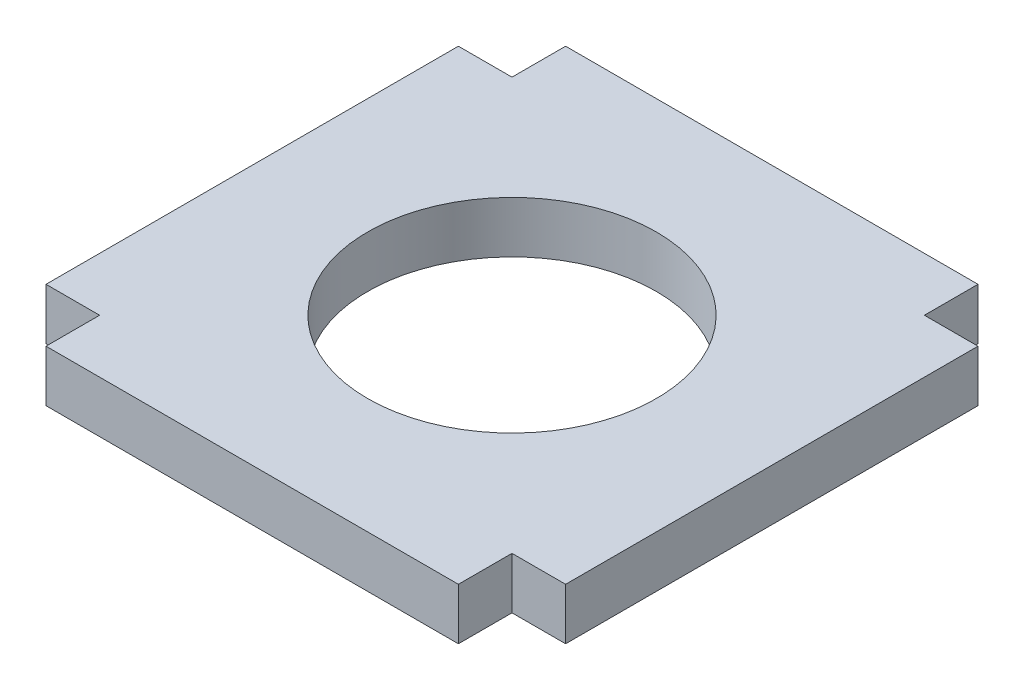
from build123d import *

# Parameters (mm, degrees)
SKETCH2_W                    = 304.8
SKETCH2_H                    = 304.8
BOSS_EXTRUDE1_DEPTH          = 3.175
CUT_EXTRUDE1_DEPTH           = 348.408852067
CUT_EXTRUDE1_DEPTH_BACK      = 348.408852067
SKETCH3_W                    = 304.8
SKETCH3_H                    = 304.8
SKETCH3_R                    = 12.7
SKETCH3_R_2                  = 8.89
BODY_DELETE_KEEP_1_OUTLINE_R = 12.7
BODY_DELETE_KEEP_1_DEPTH     = 3.175


# Read off the part's stored shape, not the designer's step: Body-Delete/Keep 1
with BuildPart() as part:
    # Sketch2 → Boss-Extrude1 (new body)
    with BuildSketch(Plane(origin=(0, 0, 0), x_dir=(1, 0, 0), z_dir=(0, 1, 0))):
        with Locations((-56.763509666, -124.968808797)):
            Rectangle(SKETCH2_W, SKETCH2_H)
    extrude(amount=BOSS_EXTRUDE1_DEPTH)

    # Sketch3 → Cut-Extrude1 (cut, two sides: drawn at the far end of the back side and taken through both)
    # profile 1 of 3: a face of its own
    with BuildSketch(Plane(origin=(0, 3.175, 0), x_dir=(1, 0, 0), z_dir=(0, 1, 0)).offset(-CUT_EXTRUDE1_DEPTH_BACK)):
        with Locations((-56.763509666, -124.968808797)):
            Rectangle(SKETCH3_W, SKETCH3_H)
        Polygon((-188.253637726, -268.695366412), (-192.063637726, -268.695366412), (-192.063637726, -265.393366412), (-198.413637726, -265.393366412), (-188.253637726, -205.195366412), align=None, mode=Mode.SUBTRACT)
        Polygon((-185.713637726, -265.393366412), (-175.553637726, -205.195366412), (-175.553637726, -268.695366412), (-179.363637726, -268.695366412), (-179.363637726, -265.393366412), align=None, mode=Mode.SUBTRACT)
        Polygon((-162.853637726, -268.695366412), (-166.663637726, -268.695366412), (-166.663637726, -265.393366412), (-173.013637726, -265.393366412), (-162.853637726, -205.195366412), align=None, mode=Mode.SUBTRACT)
        Polygon((-150.153637726, -268.695366412), (-153.963637726, -268.695366412), (-153.963637726, -265.393366412), (-160.313637726, -265.393366412), (-150.153637726, -205.195366412), align=None, mode=Mode.SUBTRACT)
        Polygon((-147.613637726, -265.393366412), (-137.453637726, -205.195366412), (-137.453637726, -268.695366412), (-141.263637726, -268.695366412), (-141.263637726, -265.393366412), align=None, mode=Mode.SUBTRACT)
        Polygon((-128.563637726, -265.393366412), (-134.913637726, -265.393366412), (-124.753637726, -205.195366412), (-124.753637726, -268.695366412), (-128.563637726, -268.695366412), align=None, mode=Mode.SUBTRACT)
        Polygon((-122.213637726, -265.393366412), (-112.053637726, -205.195366412), (-112.053637726, -268.695366412), (-115.863637726, -268.695366412), (-115.863637726, -265.393366412), align=None, mode=Mode.SUBTRACT)
        Polygon((-99.353637726, -268.695366412), (-103.163637726, -268.695366412), (-103.163637726, -265.393366412), (-109.513637726, -265.393366412), (-99.353637726, -205.195366412), align=None, mode=Mode.SUBTRACT)
        Polygon((-90.463637726, -268.695366412), (-90.463637726, -265.393366412), (-96.813637726, -265.393366412), (-86.653637726, -205.195366412), (-86.653637726, -268.695366412), align=None, mode=Mode.SUBTRACT)
        Polygon((-84.113637726, -265.393366412), (-73.953637726, -205.195366412), (-73.953637726, -268.695366412), (-77.763637726, -268.695366412), (-77.763637726, -265.393366412), align=None, mode=Mode.SUBTRACT)
        Polygon((-71.413637726, -265.393366412), (-61.253637726, -205.195366412), (-61.253637726, -268.695366412), (-65.063637726, -268.695366412), (-65.063637726, -265.393366412), align=None, mode=Mode.SUBTRACT)
        with BuildLine():
            ThreePointArc((-132.963509666, -135.600090559), (-133.446874634, -138.030130355), (-134.823381605, -140.09021862))
            Line((-134.823381605, -140.09021862), (-188.253637726, -193.520474741))
            ThreePointArc((-188.253637726, -193.520474741), (-190.313725991, -194.896981712), (-192.743765787, -195.38034668))
            Line((-192.743765787, -195.38034668), (-196.463509666, -195.38034668))
            Line((-196.463509666, -195.38034668), (-196.463509666, -131.88034668))
            Line((-196.463509666, -131.88034668), (-132.963509666, -131.88034668))
            Line((-132.963509666, -131.88034668), (-132.963509666, -135.600090559))
        make_face(mode=Mode.SUBTRACT)
        with BuildLine():
            Line((-126.613509666, -195.38034668), (-126.613509666, -131.88034668))
            Line((-126.613509666, -131.88034668), (-63.113509666, -131.88034668))
            Line((-63.113509666, -131.88034668), (-63.113509666, -135.600090559))
            ThreePointArc((-63.113509666, -135.600090559), (-63.596874634, -138.030130355), (-64.973381605, -140.09021862))
            Line((-64.973381605, -140.09021862), (-118.403637726, -193.520474741))
            ThreePointArc((-118.403637726, -193.520474741), (-120.463725991, -194.896981712), (-122.893765787, -195.38034668))
            Line((-122.893765787, -195.38034668), (-126.613509666, -195.38034668))
        make_face(mode=Mode.SUBTRACT)
        Polygon((-52.363637726, -268.695366412), (-52.363637726, -265.393366412), (-58.713637726, -265.393366412), (-48.553637726, -205.195366412), (-48.553637726, -268.695366412), align=None, mode=Mode.SUBTRACT)
        Polygon((-35.853637726, -205.195366412), (-35.853637726, -268.695366412), (-39.663637726, -268.695366412), (-39.663637726, -265.393366412), (-46.013637726, -265.393366412), align=None, mode=Mode.SUBTRACT)
        Polygon((-23.153637726, -205.195366412), (-23.153637726, -268.695366412), (-26.963637726, -268.695366412), (-26.963637726, -265.393366412), (-33.313637726, -265.393366412), align=None, mode=Mode.SUBTRACT)
        Polygon((-20.613637726, -265.393366412), (-10.453637726, -205.195366412), (-10.453637726, -268.695366412), (-14.263637726, -268.695366412), (-14.263637726, -265.393366412), align=None, mode=Mode.SUBTRACT)
        Polygon((-1.563637726, -268.695366412), (-1.563637726, -265.393366412), (-7.913637726, -265.393366412), (2.246362274, -205.195366412), (2.246362274, -268.695366412), align=None, mode=Mode.SUBTRACT)
        with BuildLine():
            Line((-53.043765787, -195.38034668), (-56.763509666, -195.38034668))
            Line((-56.763509666, -195.38034668), (-56.763509666, -131.88034668))
            Line((-56.763509666, -131.88034668), (6.736490334, -131.88034668))
            Line((6.736490334, -131.88034668), (6.736490334, -135.600090559))
            ThreePointArc((6.736490334, -135.600090559), (6.253125366, -138.030130355), (4.876618395, -140.09021862))
            Line((4.876618395, -140.09021862), (-48.553637726, -193.520474741))
            ThreePointArc((-48.553637726, -193.520474741), (-50.613725991, -194.896981712), (-53.043765787, -195.38034668))
        make_face(mode=Mode.SUBTRACT)
        with BuildLine():
            Line((13.086490334, -131.88034668), (76.586490334, -131.88034668))
            Line((76.586490334, -131.88034668), (76.586490334, -135.600090559))
            ThreePointArc((76.586490334, -135.600090559), (76.103125366, -138.030130355), (74.726618395, -140.09021862))
            Line((74.726618395, -140.09021862), (21.296362274, -193.520474741))
            ThreePointArc((21.296362274, -193.520474741), (19.236274009, -194.896981712), (16.806234213, -195.38034668))
            Line((16.806234213, -195.38034668), (13.086490334, -195.38034668))
            Line((13.086490334, -195.38034668), (13.086490334, -131.88034668))
        make_face(mode=Mode.SUBTRACT)
        with BuildLine():
            Line((-196.463509666, -125.53034668), (-196.463509666, -62.03034668))
            Line((-196.463509666, -62.03034668), (-132.963509666, -62.03034668))
            Line((-132.963509666, -62.03034668), (-132.963509666, -65.750090559))
            ThreePointArc((-132.963509666, -65.750090559), (-133.10773728, -67.095783354), (-133.533868437, -68.38034668))
            ThreePointArc((-133.533868437, -68.38034668), (-134.095097913, -69.368194866), (-134.823381605, -70.24021862))
            Line((-134.823381605, -70.24021862), (-188.253637726, -123.670474741))
            ThreePointArc((-188.253637726, -123.670474741), (-189.12566148, -124.398758433), (-190.113509666, -124.959987909))
            ThreePointArc((-190.113509666, -124.959987909), (-191.398072992, -125.386119066), (-192.743765787, -125.53034668))
            Line((-192.743765787, -125.53034668), (-196.463509666, -125.53034668))
        make_face(mode=Mode.SUBTRACT)
        with BuildLine():
            Line((-122.893765787, -125.53034668), (-126.613509666, -125.53034668))
            Line((-126.613509666, -125.53034668), (-126.613509666, -62.03034668))
            Line((-126.613509666, -62.03034668), (-63.113509666, -62.03034668))
            Line((-63.113509666, -62.03034668), (-63.113509666, -65.750090559))
            ThreePointArc((-63.113509666, -65.750090559), (-63.596874634, -68.180130355), (-64.973381605, -70.24021862))
            Line((-64.973381605, -70.24021862), (-118.403637726, -123.670474741))
            ThreePointArc((-118.403637726, -123.670474741), (-120.463725991, -125.046981712), (-122.893765787, -125.53034668))
        make_face(mode=Mode.SUBTRACT)
        Polygon((-196.463509666, -48.768808797), (-196.463509666, 14.731191203), (-192.653509666, 14.731191203), (-192.653509666, 11.429191203), (-186.303509666, 11.429191203), align=None, mode=Mode.SUBTRACT)
        Polygon((-183.763509666, 14.731191203), (-179.953509666, 14.731191203), (-179.953509666, 11.429191203), (-173.603509666, 11.429191203), (-183.763509666, -48.768808797), align=None, mode=Mode.SUBTRACT)
        Polygon((-171.063509666, 14.731191203), (-167.253509666, 14.731191203), (-167.253509666, 11.429191203), (-160.903509666, 11.429191203), (-171.063509666, -48.768808797), align=None, mode=Mode.SUBTRACT)
        Polygon((-158.363509666, 14.731191203), (-154.553509666, 14.731191203), (-154.553509666, 11.429191203), (-148.203509666, 11.429191203), (-158.363509666, -48.768808797), align=None, mode=Mode.SUBTRACT)
        Polygon((-145.663509666, 14.731191203), (-141.853509666, 14.731191203), (-141.853509666, 11.429191203), (-135.503509666, 11.429191203), (-145.663509666, -48.768808797), align=None, mode=Mode.SUBTRACT)
        Polygon((-132.963509666, 14.731191203), (-129.153509666, 14.731191203), (-129.153509666, 11.429191203), (-122.803509666, 11.429191203), (-132.963509666, -48.768808797), align=None, mode=Mode.SUBTRACT)
        Polygon((-120.263509666, 14.731191203), (-116.453509666, 14.731191203), (-116.453509666, 11.429191203), (-110.103509666, 11.429191203), (-120.263509666, -48.768808797), align=None, mode=Mode.SUBTRACT)
        Polygon((-107.563509666, 14.731191203), (-103.753509666, 14.731191203), (-103.753509666, 11.429191203), (-97.403509666, 11.429191203), (-107.563509666, -48.768808797), align=None, mode=Mode.SUBTRACT)
        Polygon((-94.863509666, 14.731191203), (-91.053509666, 14.731191203), (-91.053509666, 11.429191203), (-84.703509666, 11.429191203), (-94.863509666, -48.768808797), align=None, mode=Mode.SUBTRACT)
        Polygon((-82.163509666, 14.731191203), (-78.353509666, 14.731191203), (-78.353509666, 11.429191203), (-72.003509666, 11.429191203), (-82.163509666, -48.768808797), align=None, mode=Mode.SUBTRACT)
        Polygon((-69.463509666, 14.731191203), (-65.653509666, 14.731191203), (-65.653509666, 11.429191203), (-59.303509666, 11.429191203), (-69.463509666, -48.768808797), align=None, mode=Mode.SUBTRACT)
        with BuildLine():
            Line((-53.043765787, -125.53034668), (-56.763509666, -125.53034668))
            Line((-56.763509666, -125.53034668), (-56.763509666, -62.03034668))
            Line((-56.763509666, -62.03034668), (6.736490334, -62.03034668))
            Line((6.736490334, -62.03034668), (6.736490334, -65.750090559))
            ThreePointArc((6.736490334, -65.750090559), (6.253125366, -68.180130355), (4.876618395, -70.24021862))
            Line((4.876618395, -70.24021862), (-48.553637726, -123.670474741))
            ThreePointArc((-48.553637726, -123.670474741), (-50.613725991, -125.046981712), (-53.043765787, -125.53034668))
        make_face(mode=Mode.SUBTRACT)
        with BuildLine():
            Line((16.806234213, -125.53034668), (13.086490334, -125.53034668))
            Line((13.086490334, -125.53034668), (13.086490334, -62.03034668))
            Line((13.086490334, -62.03034668), (76.586490334, -62.03034668))
            Line((76.586490334, -62.03034668), (76.586490334, -65.750090559))
            ThreePointArc((76.586490334, -65.750090559), (76.103125366, -68.180130355), (74.726618395, -70.24021862))
            Line((74.726618395, -70.24021862), (21.296362274, -123.670474741))
            ThreePointArc((21.296362274, -123.670474741), (19.236274009, -125.046981712), (16.806234213, -125.53034668))
        make_face(mode=Mode.SUBTRACT)
        Polygon((-56.763509666, 14.731191203), (-52.953509666, 14.731191203), (-52.953509666, 11.429191203), (-46.603509666, 11.429191203), (-56.763509666, -48.768808797), align=None, mode=Mode.SUBTRACT)
        Polygon((-44.063509666, 14.731191203), (-40.253509666, 14.731191203), (-40.253509666, 11.429191203), (-33.903509666, 11.429191203), (-44.063509666, -48.768808797), align=None, mode=Mode.SUBTRACT)
        Polygon((-31.363509666, 14.731191203), (-27.553509666, 14.731191203), (-27.553509666, 11.429191203), (-21.203509666, 11.429191203), (-31.363509666, -48.768808797), align=None, mode=Mode.SUBTRACT)
        Polygon((-18.663509666, 14.731191203), (-14.853509666, 14.731191203), (-14.853509666, 11.429191203), (-8.503509666, 11.429191203), (-18.663509666, -48.768808797), align=None, mode=Mode.SUBTRACT)
        Polygon((-5.963509666, 14.731191203), (-2.153509666, 14.731191203), (-2.153509666, 11.429191203), (4.196490334, 11.429191203), (-5.963509666, -48.768808797), align=None, mode=Mode.SUBTRACT)
        Polygon((57.536490334, -48.768808797), (57.536490334, -52.070808797), (32.136490334, -52.070808797), (32.136490334, -48.768808797), (28.834490334, -48.768808797), (28.834490334, -23.368808797), (32.136490334, -23.368808797), (32.136490334, -20.066808797), (57.536490334, -20.066808797), (57.536490334, -23.368808797), (60.838490334, -23.368808797), (60.838490334, -48.768808797), align=None, mode=Mode.SUBTRACT)
        Polygon((28.834490334, 14.731191203), (32.136490334, 14.731191203), (32.136490334, 18.033191203), (57.536490334, 18.033191203), (57.536490334, 14.731191203), (60.838490334, 14.731191203), (60.838490334, -10.668808797), (57.536490334, -10.668808797), (57.536490334, -13.970808797), (32.136490334, -13.970808797), (32.136490334, -10.668808797), (28.834490334, -10.668808797), align=None, mode=Mode.SUBTRACT)
    # profile 2 of 3: a face of its own
    with BuildSketch(Plane(origin=(0, 3.175, 0), x_dir=(1, 0, 0), z_dir=(0, 1, 0)).offset(-CUT_EXTRUDE1_DEPTH_BACK)):
        with Locations(Location((44.836490334, -36.068808797, 0), (0, 0, 270))):
            Circle(SKETCH3_R)
    # profile 3 of 3: a face of its own
    with BuildSketch(Plane(origin=(0, 3.175, 0), x_dir=(1, 0, 0), z_dir=(0, 1, 0)).offset(-CUT_EXTRUDE1_DEPTH_BACK)):
        with Locations(Location((44.836490334, 2.031191203, 0), (0, 0, 270))):
            Circle(SKETCH3_R_2)
    extrude(amount=CUT_EXTRUDE1_DEPTH + CUT_EXTRUDE1_DEPTH_BACK, mode=Mode.SUBTRACT)

    # Body-Delete/Keep 1 outline → Body-Delete/Keep 1 (cut)
    # profile 1 of 41: a face of its own
    with BuildSketch(Plane(origin=(0, 0, 0), x_dir=(1, 0, 0), z_dir=(0, 1, 0))):
        Polygon((60.838490334, -23.368808797), (57.536490334, -23.368808797), (57.536490334, -20.066808797), (32.136490334, -20.066808797), (32.136490334, -23.368808797), (28.834490334, -23.368808797), (28.834490334, -48.768808797), (32.136490334, -48.768808797), (32.136490334, -52.070808797), (57.536490334, -52.070808797), (57.536490334, -48.768808797), (60.838490334, -48.768808797), align=None)
        with Locations((44.836490334, -36.068808797)):
            Circle(BODY_DELETE_KEEP_1_OUTLINE_R, mode=Mode.SUBTRACT)
    # profile 2 of 41: a face of its own
    with BuildSketch(Plane(origin=(0, 0, 0), x_dir=(1, 0, 0), z_dir=(0, 1, 0))):
        Polygon((-192.653509666, 11.429191203), (-192.653509666, 14.731191203), (-196.463509666, 14.731191203), (-196.463509666, -48.768808797), (-186.303509666, 11.429191203), align=None)
    # profile 3 of 41: a face of its own
    with BuildSketch(Plane(origin=(0, 0, 0), x_dir=(1, 0, 0), z_dir=(0, 1, 0))):
        Polygon((-2.153509666, 11.429191203), (-2.153509666, 14.731191203), (-5.963509666, 14.731191203), (-5.963509666, -48.768808797), (4.196490334, 11.429191203), align=None)
    # profile 4 of 41: a face of its own
    with BuildSketch(Plane(origin=(0, 0, 0), x_dir=(1, 0, 0), z_dir=(0, 1, 0))):
        Polygon((-27.553509666, 11.429191203), (-27.553509666, 14.731191203), (-31.363509666, 14.731191203), (-31.363509666, -48.768808797), (-21.203509666, 11.429191203), align=None)
    # profile 5 of 41: a face of its own
    with BuildSketch(Plane(origin=(0, 0, 0), x_dir=(1, 0, 0), z_dir=(0, 1, 0))):
        Polygon((-14.853509666, 11.429191203), (-14.853509666, 14.731191203), (-18.663509666, 14.731191203), (-18.663509666, -48.768808797), (-8.503509666, 11.429191203), align=None)
    # profile 6 of 41: a face of its own
    with BuildSketch(Plane(origin=(0, 0, 0), x_dir=(1, 0, 0), z_dir=(0, 1, 0))):
        Polygon((-65.653509666, 11.429191203), (-65.653509666, 14.731191203), (-69.463509666, 14.731191203), (-69.463509666, -48.768808797), (-59.303509666, 11.429191203), align=None)
    # profile 7 of 41: a face of its own
    with BuildSketch(Plane(origin=(0, 0, 0), x_dir=(1, 0, 0), z_dir=(0, 1, 0))):
        Polygon((-91.053509666, 11.429191203), (-91.053509666, 14.731191203), (-94.863509666, 14.731191203), (-94.863509666, -48.768808797), (-84.703509666, 11.429191203), align=None)
    # profile 8 of 41: a face of its own
    with BuildSketch(Plane(origin=(0, 0, 0), x_dir=(1, 0, 0), z_dir=(0, 1, 0))):
        Polygon((-40.253509666, 11.429191203), (-40.253509666, 14.731191203), (-44.063509666, 14.731191203), (-44.063509666, -48.768808797), (-33.903509666, 11.429191203), align=None)
    # profile 9 of 41: a face of its own
    with BuildSketch(Plane(origin=(0, 0, 0), x_dir=(1, 0, 0), z_dir=(0, 1, 0))):
        Polygon((-52.953509666, 11.429191203), (-52.953509666, 14.731191203), (-56.763509666, 14.731191203), (-56.763509666, -48.768808797), (-46.603509666, 11.429191203), align=None)
    # profile 10 of 41: a face of its own
    with BuildSketch(Plane(origin=(0, 0, 0), x_dir=(1, 0, 0), z_dir=(0, 1, 0))):
        Polygon((-141.853509666, 11.429191203), (-141.853509666, 14.731191203), (-145.663509666, 14.731191203), (-145.663509666, -48.768808797), (-135.503509666, 11.429191203), align=None)
    # profile 11 of 41: a face of its own
    with BuildSketch(Plane(origin=(0, 0, 0), x_dir=(1, 0, 0), z_dir=(0, 1, 0))):
        Polygon((-154.553509666, 11.429191203), (-154.553509666, 14.731191203), (-158.363509666, 14.731191203), (-158.363509666, -48.768808797), (-148.203509666, 11.429191203), align=None)
    # profile 12 of 41: a face of its own
    with BuildSketch(Plane(origin=(0, 0, 0), x_dir=(1, 0, 0), z_dir=(0, 1, 0))):
        Polygon((-167.253509666, 11.429191203), (-167.253509666, 14.731191203), (-171.063509666, 14.731191203), (-171.063509666, -48.768808797), (-160.903509666, 11.429191203), align=None)
    # profile 13 of 41: a face of its own
    with BuildSketch(Plane(origin=(0, 0, 0), x_dir=(1, 0, 0), z_dir=(0, 1, 0))):
        Polygon((-78.353509666, 11.429191203), (-78.353509666, 14.731191203), (-82.163509666, 14.731191203), (-82.163509666, -48.768808797), (-72.003509666, 11.429191203), align=None)
    # profile 14 of 41: a face of its own
    with BuildSketch(Plane(origin=(0, 0, 0), x_dir=(1, 0, 0), z_dir=(0, 1, 0))):
        Polygon((-179.953509666, 11.429191203), (-179.953509666, 14.731191203), (-183.763509666, 14.731191203), (-183.763509666, -48.768808797), (-173.603509666, 11.429191203), align=None)
    # profile 15 of 41: a face of its own
    with BuildSketch(Plane(origin=(0, 0, 0), x_dir=(1, 0, 0), z_dir=(0, 1, 0))):
        Polygon((-103.753509666, 11.429191203), (-103.753509666, 14.731191203), (-107.563509666, 14.731191203), (-107.563509666, -48.768808797), (-97.403509666, 11.429191203), align=None)
    # profile 16 of 41: a face of its own
    with BuildSketch(Plane(origin=(0, 0, 0), x_dir=(1, 0, 0), z_dir=(0, 1, 0))):
        Polygon((-116.453509666, 11.429191203), (-116.453509666, 14.731191203), (-120.263509666, 14.731191203), (-120.263509666, -48.768808797), (-110.103509666, 11.429191203), align=None)
    # profile 17 of 41: a face of its own
    with BuildSketch(Plane(origin=(0, 0, 0), x_dir=(1, 0, 0), z_dir=(0, 1, 0))):
        Polygon((-129.153509666, 11.429191203), (-129.153509666, 14.731191203), (-132.963509666, 14.731191203), (-132.963509666, -48.768808797), (-122.803509666, 11.429191203), align=None)
    # profile 18 of 41: a face of its own
    with BuildSketch(Plane(origin=(0, 0, 0), x_dir=(1, 0, 0), z_dir=(0, 1, 0))):
        Polygon((-71.413637726, -265.393366412), (-65.063637726, -265.393366412), (-65.063637726, -268.695366412), (-61.253637726, -268.695366412), (-61.253637726, -205.195366412), align=None)
    # profile 19 of 41: a face of its own
    with BuildSketch(Plane(origin=(0, 0, 0), x_dir=(1, 0, 0), z_dir=(0, 1, 0))):
        Polygon((-124.753637726, -205.195366412), (-134.913637726, -265.393366412), (-128.563637726, -265.393366412), (-128.563637726, -268.695366412), (-124.753637726, -268.695366412), align=None)
    # profile 20 of 41: a face of its own
    with BuildSketch(Plane(origin=(0, 0, 0), x_dir=(1, 0, 0), z_dir=(0, 1, 0))):
        Polygon((-23.153637726, -205.195366412), (-33.313637726, -265.393366412), (-26.963637726, -265.393366412), (-26.963637726, -268.695366412), (-23.153637726, -268.695366412), align=None)
    # profile 21 of 41: a face of its own
    with BuildSketch(Plane(origin=(0, 0, 0), x_dir=(1, 0, 0), z_dir=(0, 1, 0))):
        Polygon((-35.853637726, -205.195366412), (-46.013637726, -265.393366412), (-39.663637726, -265.393366412), (-39.663637726, -268.695366412), (-35.853637726, -268.695366412), align=None)
    # profile 22 of 41: a face of its own
    with BuildSketch(Plane(origin=(0, 0, 0), x_dir=(1, 0, 0), z_dir=(0, 1, 0))):
        Polygon((-73.953637726, -205.195366412), (-84.113637726, -265.393366412), (-77.763637726, -265.393366412), (-77.763637726, -268.695366412), (-73.953637726, -268.695366412), align=None)
    # profile 23 of 41: a face of its own
    with BuildSketch(Plane(origin=(0, 0, 0), x_dir=(1, 0, 0), z_dir=(0, 1, 0))):
        Polygon((-162.853637726, -205.195366412), (-173.013637726, -265.393366412), (-166.663637726, -265.393366412), (-166.663637726, -268.695366412), (-162.853637726, -268.695366412), align=None)
    # profile 24 of 41: a face of its own
    with BuildSketch(Plane(origin=(0, 0, 0), x_dir=(1, 0, 0), z_dir=(0, 1, 0))):
        Polygon((-188.253637726, -205.195366412), (-198.413637726, -265.393366412), (-192.063637726, -265.393366412), (-192.063637726, -268.695366412), (-188.253637726, -268.695366412), align=None)
    # profile 25 of 41: a face of its own
    with BuildSketch(Plane(origin=(0, 0, 0), x_dir=(1, 0, 0), z_dir=(0, 1, 0))):
        Polygon((-175.553637726, -205.195366412), (-185.713637726, -265.393366412), (-179.363637726, -265.393366412), (-179.363637726, -268.695366412), (-175.553637726, -268.695366412), align=None)
    # profile 26 of 41: a face of its own
    with BuildSketch(Plane(origin=(0, 0, 0), x_dir=(1, 0, 0), z_dir=(0, 1, 0))):
        Polygon((-150.153637726, -205.195366412), (-160.313637726, -265.393366412), (-153.963637726, -265.393366412), (-153.963637726, -268.695366412), (-150.153637726, -268.695366412), align=None)
    # profile 27 of 41: a face of its own
    with BuildSketch(Plane(origin=(0, 0, 0), x_dir=(1, 0, 0), z_dir=(0, 1, 0))):
        Polygon((-86.653637726, -205.195366412), (-96.813637726, -265.393366412), (-90.463637726, -265.393366412), (-90.463637726, -268.695366412), (-86.653637726, -268.695366412), align=None)
    # profile 28 of 41: a face of its own
    with BuildSketch(Plane(origin=(0, 0, 0), x_dir=(1, 0, 0), z_dir=(0, 1, 0))):
        Polygon((2.246362274, -205.195366412), (-7.913637726, -265.393366412), (-1.563637726, -265.393366412), (-1.563637726, -268.695366412), (2.246362274, -268.695366412), align=None)
    # profile 29 of 41: a face of its own
    with BuildSketch(Plane(origin=(0, 0, 0), x_dir=(1, 0, 0), z_dir=(0, 1, 0))):
        Polygon((-137.453637726, -205.195366412), (-147.613637726, -265.393366412), (-141.263637726, -265.393366412), (-141.263637726, -268.695366412), (-137.453637726, -268.695366412), align=None)
    # profile 30 of 41: a face of its own
    with BuildSketch(Plane(origin=(0, 0, 0), x_dir=(1, 0, 0), z_dir=(0, 1, 0))):
        Polygon((-48.553637726, -205.195366412), (-58.713637726, -265.393366412), (-52.363637726, -265.393366412), (-52.363637726, -268.695366412), (-48.553637726, -268.695366412), align=None)
    # profile 31 of 41: a face of its own
    with BuildSketch(Plane(origin=(0, 0, 0), x_dir=(1, 0, 0), z_dir=(0, 1, 0))):
        Polygon((-10.453637726, -205.195366412), (-20.613637726, -265.393366412), (-14.263637726, -265.393366412), (-14.263637726, -268.695366412), (-10.453637726, -268.695366412), align=None)
    # profile 32 of 41: a face of its own
    with BuildSketch(Plane(origin=(0, 0, 0), x_dir=(1, 0, 0), z_dir=(0, 1, 0))):
        Polygon((-99.353637726, -205.195366412), (-109.513637726, -265.393366412), (-103.163637726, -265.393366412), (-103.163637726, -268.695366412), (-99.353637726, -268.695366412), align=None)
    # profile 33 of 41: a face of its own
    with BuildSketch(Plane(origin=(0, 0, 0), x_dir=(1, 0, 0), z_dir=(0, 1, 0))):
        Polygon((-112.053637726, -205.195366412), (-122.213637726, -265.393366412), (-115.863637726, -265.393366412), (-115.863637726, -268.695366412), (-112.053637726, -268.695366412), align=None)
    # profile 34 of 41: a face of its own
    with BuildSketch(Plane(origin=(0, 0, 0), x_dir=(1, 0, 0), z_dir=(0, 1, 0))):
        with BuildLine():
            Line((-132.963509666, -62.03034668), (-196.463509666, -62.03034668))
            Line((-196.463509666, -62.03034668), (-196.463509666, -125.53034668))
            Line((-196.463509666, -125.53034668), (-192.743765787, -125.53034668))
            ThreePointArc((-192.743765787, -125.53034668), (-190.313725991, -125.046981712), (-188.253637726, -123.670474741))
            Line((-188.253637726, -123.670474741), (-134.823381605, -70.24021862))
            ThreePointArc((-134.823381605, -70.24021862), (-133.446874634, -68.180130355), (-132.963509666, -65.750090559))
            Line((-132.963509666, -65.750090559), (-132.963509666, -62.03034668))
        make_face()
    # profile 35 of 41: a face of its own
    with BuildSketch(Plane(origin=(0, 0, 0), x_dir=(1, 0, 0), z_dir=(0, 1, 0))):
        with BuildLine():
            Line((-132.963509666, -131.88034668), (-196.463509666, -131.88034668))
            Line((-196.463509666, -131.88034668), (-196.463509666, -195.38034668))
            Line((-196.463509666, -195.38034668), (-192.743765787, -195.38034668))
            ThreePointArc((-192.743765787, -195.38034668), (-190.313725991, -194.896981712), (-188.253637726, -193.520474741))
            Line((-188.253637726, -193.520474741), (-134.823381605, -140.09021862))
            ThreePointArc((-134.823381605, -140.09021862), (-133.446874634, -138.030130355), (-132.963509666, -135.600090559))
            Line((-132.963509666, -135.600090559), (-132.963509666, -131.88034668))
        make_face()
    # profile 36 of 41: a face of its own
    with BuildSketch(Plane(origin=(0, 0, 0), x_dir=(1, 0, 0), z_dir=(0, 1, 0))):
        with BuildLine():
            Line((6.736490334, -131.88034668), (-56.763509666, -131.88034668))
            Line((-56.763509666, -131.88034668), (-56.763509666, -195.38034668))
            Line((-56.763509666, -195.38034668), (-53.043765787, -195.38034668))
            ThreePointArc((-53.043765787, -195.38034668), (-50.613725991, -194.896981712), (-48.553637726, -193.520474741))
            Line((-48.553637726, -193.520474741), (4.876618395, -140.09021862))
            ThreePointArc((4.876618395, -140.09021862), (6.253125366, -138.030130355), (6.736490334, -135.600090559))
            Line((6.736490334, -135.600090559), (6.736490334, -131.88034668))
        make_face()
    # profile 37 of 41: a face of its own
    with BuildSketch(Plane(origin=(0, 0, 0), x_dir=(1, 0, 0), z_dir=(0, 1, 0))):
        with BuildLine():
            Line((6.736490334, -62.03034668), (-56.763509666, -62.03034668))
            Line((-56.763509666, -62.03034668), (-56.763509666, -125.53034668))
            Line((-56.763509666, -125.53034668), (-53.043765787, -125.53034668))
            ThreePointArc((-53.043765787, -125.53034668), (-50.613725991, -125.046981712), (-48.553637726, -123.670474741))
            Line((-48.553637726, -123.670474741), (4.876618395, -70.24021862))
            ThreePointArc((4.876618395, -70.24021862), (6.253125366, -68.180130355), (6.736490334, -65.750090559))
            Line((6.736490334, -65.750090559), (6.736490334, -62.03034668))
        make_face()
    # profile 38 of 41: a face of its own
    with BuildSketch(Plane(origin=(0, 0, 0), x_dir=(1, 0, 0), z_dir=(0, 1, 0))):
        with BuildLine():
            Line((21.296362274, -193.520474741), (74.726618395, -140.09021862))
            ThreePointArc((74.726618395, -140.09021862), (76.103125366, -138.030130355), (76.586490334, -135.600090559))
            Line((76.586490334, -135.600090559), (76.586490334, -131.88034668))
            Line((76.586490334, -131.88034668), (13.086490334, -131.88034668))
            Line((13.086490334, -131.88034668), (13.086490334, -195.38034668))
            Line((13.086490334, -195.38034668), (16.806234213, -195.38034668))
            ThreePointArc((16.806234213, -195.38034668), (19.236274009, -194.896981712), (21.296362274, -193.520474741))
        make_face()
    # profile 39 of 41: a face of its own
    with BuildSketch(Plane(origin=(0, 0, 0), x_dir=(1, 0, 0), z_dir=(0, 1, 0))):
        with BuildLine():
            Line((-126.613509666, -131.88034668), (-126.613509666, -195.38034668))
            Line((-126.613509666, -195.38034668), (-122.893765787, -195.38034668))
            ThreePointArc((-122.893765787, -195.38034668), (-120.463725991, -194.896981712), (-118.403637726, -193.520474741))
            Line((-118.403637726, -193.520474741), (-64.973381605, -140.09021862))
            ThreePointArc((-64.973381605, -140.09021862), (-63.596874634, -138.030130355), (-63.113509666, -135.600090559))
            Line((-63.113509666, -135.600090559), (-63.113509666, -131.88034668))
            Line((-63.113509666, -131.88034668), (-126.613509666, -131.88034668))
        make_face()
    # profile 40 of 41: a face of its own
    with BuildSketch(Plane(origin=(0, 0, 0), x_dir=(1, 0, 0), z_dir=(0, 1, 0))):
        with BuildLine():
            Line((76.586490334, -62.03034668), (13.086490334, -62.03034668))
            Line((13.086490334, -62.03034668), (13.086490334, -125.53034668))
            Line((13.086490334, -125.53034668), (16.806234213, -125.53034668))
            ThreePointArc((16.806234213, -125.53034668), (19.236274009, -125.046981712), (21.296362274, -123.670474741))
            Line((21.296362274, -123.670474741), (74.726618395, -70.24021862))
            ThreePointArc((74.726618395, -70.24021862), (76.103125366, -68.180130355), (76.586490334, -65.750090559))
            Line((76.586490334, -65.750090559), (76.586490334, -62.03034668))
        make_face()
    # profile 41 of 41: a face of its own
    with BuildSketch(Plane(origin=(0, 0, 0), x_dir=(1, 0, 0), z_dir=(0, 1, 0))):
        with BuildLine():
            Line((-126.613509666, -62.03034668), (-126.613509666, -125.53034668))
            Line((-126.613509666, -125.53034668), (-122.893765787, -125.53034668))
            ThreePointArc((-122.893765787, -125.53034668), (-120.463725991, -125.046981712), (-118.403637726, -123.670474741))
            Line((-118.403637726, -123.670474741), (-64.973381605, -70.24021862))
            ThreePointArc((-64.973381605, -70.24021862), (-63.596874634, -68.180130355), (-63.113509666, -65.750090559))
            Line((-63.113509666, -65.750090559), (-63.113509666, -62.03034668))
            Line((-63.113509666, -62.03034668), (-126.613509666, -62.03034668))
        make_face()
    extrude(amount=BODY_DELETE_KEEP_1_DEPTH, mode=Mode.SUBTRACT)


solid = part.part
